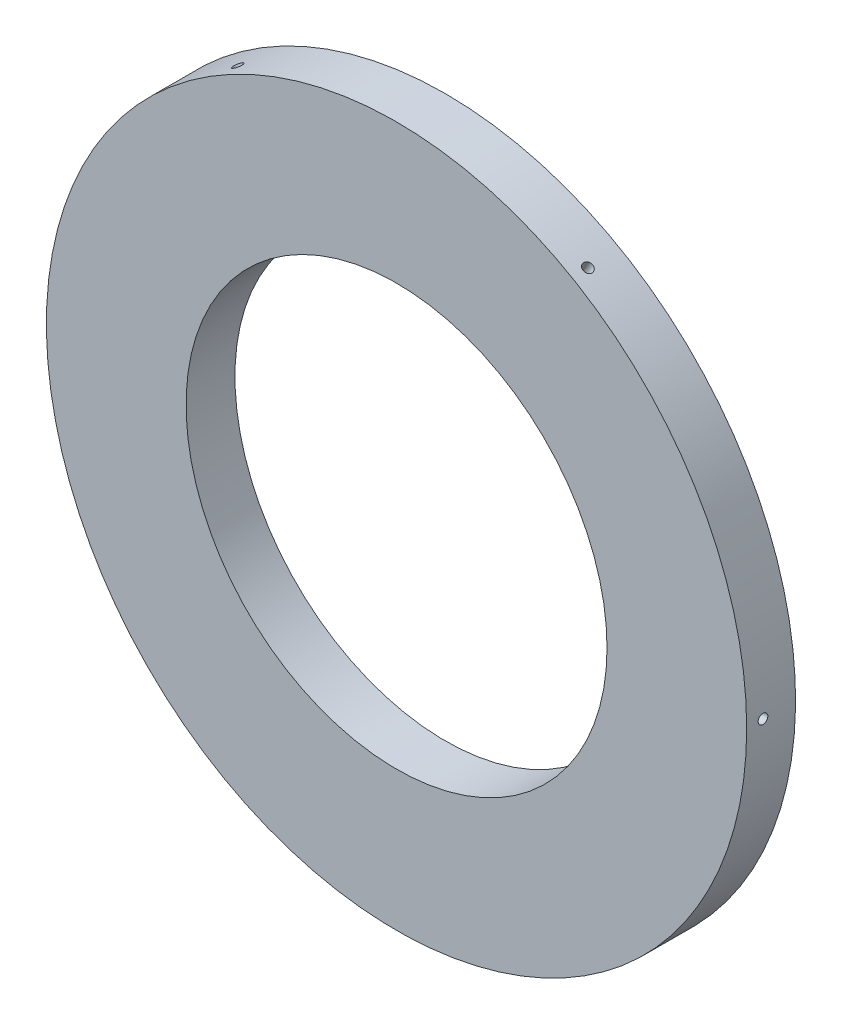
from build123d import *

# Parameters (mm, degrees)
SKETCH1_R                         = 81.8896
SKETCH1_R_2                       = 49.225199999999994
BOSS_EXTRUDE1_DEPTH               = 11.43
CIRPATTERN1_COUNT                 = 6
CUT_EXTRUDE1_DEPTH                = 10.921999999999999
FILLET2_R                         = 4.9276
FILLET4_R                         = 6.35
CIRPATTERN2_COUNT                 = 6
FILLET2_OF_CIRPATTERN2_R          = 4.9276
FILLET4_OF_CIRPATTERN2_R          = 6.35
BOSS_EXTRUDE2_DEPTH               = 19.05
CUT_EXTRUDE2_REACH                = 187.575
CUT_EXTRUDE2_END_RADIUS           = 81.8896
DRAFT1_ANGLE                      = -12.500000000000027
RIB5_REACH                        = 120.34
RIB6_DEPTH                        = 10.922
FILLET5_R                         = 2.54
CHAMFER2_SIZE                     = 5.08
CHAMFER4_SIZE                     = 5.08
TAPPED_HOLE_FOR_10_24_HELICOIL1_D = 5.15874
FILLET6_R                         = 6.35
FILLET13_R                        = 4.9276
FILLET14_R                        = 1.5875
FILLET15_R                        = 1.5875


with BuildPart() as part:
    # Sketch1 → Boss-Extrude1 (new body)
    with BuildSketch(Plane.XY):
        Circle(SKETCH1_R)
        Circle(SKETCH1_R_2, mode=Mode.SUBTRACT)
    extrude(amount=BOSS_EXTRUDE1_DEPTH)

    # Sketch2 → #4-40 Tapped Hole1 (revolve, cut)
    with BuildSketch(Plane(origin=(81.8896, 0, 7.62), x_dir=(0, 0, -1), z_dir=(-1.2e-16, 1, 0))):
        Polygon((0, 0), (-2.03e-15, 8.273752757686852), (1.130299999999998, 7.594599999999999), (1.130299999999999, -1e-17), align=None)
    f_4_40_tapped_hole1 = revolve(axis=Axis((88.2396, 7.8e-16, 7.62), (-1, -1.2e-16, 0)), mode=Mode.SUBTRACT)

    # CirPattern1: #4-40 Tapped Hole1 ×6 about axis
    cirpattern1_axis = Axis((0, 0, 11.43), (0, 0, -1))
    for i in range(1, CIRPATTERN1_COUNT):
        add(f_4_40_tapped_hole1.rotate(cirpattern1_axis, i * 360 / CIRPATTERN1_COUNT), mode=Mode.SUBTRACT)

    # Sketch3 → Cut-Extrude1 (cut)
    with BuildSketch(Plane.XY):
        with BuildLine():
            ThreePointArc((27.78089806339295, 42.682326925688685), (44.10407573853007, 25.463500000000053), (50.85442844197543, 2.7178))
            Line((50.85442844197543, 2.7178), (81.08206364492705, 2.7178))
            ThreePointArc((81.08206364492705, 2.7177999999999995), (70.25856254806233, 40.56380000000017), (42.894715664868535, 68.86022690777371))
            Line((42.8947156648687, 68.86022690777364), (27.780898063392954, 42.682326925688685))
        make_face()
    cut_extrude1 = extrude(amount=CUT_EXTRUDE1_DEPTH, mode=Mode.SUBTRACT)

    # Fillet2
    fillet2_edges = [part.edges().sort_by_distance(p)[0] for p in [
        (81.08206364492705, 2.7177999999999995, 5.460999999999999),
        (42.89471566486861, 68.86022690777367, 5.460999999999999),
    ]]
    fillet(fillet2_edges, radius=FILLET2_R)

    # Fillet4
    fillet4_edges = [part.edges().sort_by_distance(p)[0] for p in [
        (50.85442844197543, 2.717800000000004, 5.460999999999999),
        (27.780898063392954, 42.682326925688685, 5.460999999999999),
    ]]
    fillet(fillet4_edges, radius=FILLET4_R)

    # CirPattern2: Cut-Extrude1 ×6 about axis
    cirpattern2_axis = Axis((2.013e-14, -3.353e-14, 0), (0, 0, 1))
    for i in range(1, CIRPATTERN2_COUNT):
        add(cut_extrude1.rotate(cirpattern2_axis, i * 360 / CIRPATTERN2_COUNT), mode=Mode.SUBTRACT)

    # Fillet2 of CirPattern2
    fillet2_of_cirpattern2_edges = [part.edges().sort_by_distance(p)[0] for p in [
        (38.18734798005816, 71.57802690777348, 5.460999999999999),
        (-38.18734798005847, 71.57802690777334, 5.460999999999999),
        (-42.89471566486885, 68.86022690777342, 5.460999999999999),
        (-81.08206364492706, 2.7177999999996447, 5.460999999999999),
        (-81.082063644927, -2.717800000000057, 5.460999999999999),
        (-42.89471566486858, -68.86022690777374, 5.460999999999999),
        (-38.187347980058156, -71.5780269077735, 5.460999999999999),
        (38.187347980058476, -71.5780269077734, 5.460999999999999),
        (42.89471566486892, -68.8602269077735, 5.460999999999999),
        (81.0820636449271, -2.7177999999996834, 5.460999999999999),
    ]]
    fillet(fillet2_of_cirpattern2_edges, radius=FILLET2_OF_CIRPATTERN2_R)

    # Fillet4 of CirPattern2
    fillet4_of_cirpattern2_edges = [part.edges().sort_by_distance(p)[0] for p in [
        (23.073530378582355, 45.40012692568858, 5.460999999999999),
        (-23.073530378582497, 45.40012692568852, 5.460999999999999),
        (-27.780898063393053, 42.68232692568854, 5.460999999999999),
        (-50.854428441975436, 2.7177999999998153, 5.460999999999999),
        (-50.85442844197539, -2.717800000000065, 5.460999999999999),
        (-27.780898063392918, -42.68232692568875, 5.460999999999999),
        (-23.073530378582326, -45.40012692568864, 5.460999999999999),
        (23.07353037858252, -45.4001269256886, 5.460999999999999),
        (27.78089806339311, -42.682326925688606, 5.460999999999999),
        (50.854428441975486, -2.7177999999998645, 5.460999999999999),
    ]]
    fillet(fillet4_of_cirpattern2_edges, radius=FILLET4_OF_CIRPATTERN2_R)


with BuildPart() as body_2:
    # Sketch5 → Boss-Extrude2 (new body)
    with BuildSketch(Plane(origin=(0, -83.82, 0), x_dir=(1, 0, 0), z_dir=(0, 1, 0))):
        Polygon((9.525, 16.510000000000016), (-9.525, 16.510000000000016), (-9.524999999999995, -11.429999999999993), (9.524999999999995, -11.429999999999993), align=None)
    extrude(amount=BOSS_EXTRUDE2_DEPTH)

    # Cut-Extrude2: up to this cylinder (the profile starts outside it)
    cut_extrude2_end = Plane(origin=(0, 0, 6.985), z_dir=(0, 0, -1)) * Cylinder(CUT_EXTRUDE2_END_RADIUS, 539.9292, mode=Mode.PRIVATE)
    # Sketch6 → Cut-Extrude2 (cut, up to the surface)
    with BuildSketch(Plane.XZ.offset(83.82), mode=Mode.PRIVATE) as cut_extrude2_sk1:
        Polygon((9.524999999999999, 11.43), (-9.525, 11.429999999999996), (-9.525, 2.5399999999999796), (9.525, 2.539999999999985), align=None)
    cut_extrude2_tool1 = extrude(cut_extrude2_sk1.sketch, amount=-CUT_EXTRUDE2_REACH, mode=Mode.PRIVATE) - cut_extrude2_end
    add(cut_extrude2_tool1.solids().sort_by_distance((0, -83.82, 6.985))[0], mode=Mode.SUBTRACT)

    # Draft1
    draft1_faces = [body_2.faces().sort_by_distance(p)[0] for p in [
        (9.524999999999999, -73.93618404946444, -2.952674581292372),
        (-9.524999999999999, -73.93618404946444, -2.9526745812923716),
    ]]
    draft(draft1_faces, Plane(origin=(0, -83.82, 0), x_dir=(0, 0, -1), z_dir=(0, -1, 0)), DRAFT1_ANGLE)

    # Combine2: union part
    add(part.part)

    # Sketch14 walls → Rib5 (add, up to next)
    with BuildSketch(Plane.XY, mode=Mode.PRIVATE) as rib5_sk1:
        Polygon((-106.27487502239977, 40.063543037019265), (75.6466556340094, -155.89211494552436), (78.4388638034492, -153.29988163455218), (-103.48266685295998, 42.65577634799143), align=None)
    rib5_tool1 = extrude(rib5_sk1.sketch, amount=RIB5_REACH, mode=Mode.PRIVATE) - body_2.part
    # Sketch14 walls → Rib5 (add, up to next)
    with BuildSketch(Plane.XY, mode=Mode.PRIVATE) as rib5_sk2:
        Polygon((103.48266685295998, 42.65577634799143), (-78.4388638034492, -153.29988163455218), (-75.6466556340094, -155.89211494552436), (106.27487502239977, 40.063543037019265), align=None)
    rib5_tool2 = extrude(rib5_sk2.sketch, amount=RIB5_REACH, mode=Mode.PRIVATE) - body_2.part
    add(rib5_tool1.solids().sort_by_distance((-13.918005609, -56.618169299, 0))[0])
    add(rib5_tool2.solids().sort_by_distance((13.918005609, -56.618169299, 0))[0])

    # Rib6: read off the stored shape, not the designer's step
    # Rib6 outline → Rib6 (add)
    with BuildSketch(Plane.XY):
        with BuildLine():
            ThreePointArc((36.089276142, -68.378179395), (22.448876522, -73.98688541), (7.991643943, -76.903477794))
            Line((7.991643943, -76.903477794), (8.821467426, -80.646569637))
            ThreePointArc((8.821467426, -80.646569637), (21.32821315, -78.273844965), (33.309834399, -73.973930638))
            ThreePointArc((33.309834399, -73.973930638), (35.699811536, -71.672888042), (36.089276142, -68.378179395))
        make_face()
        with BuildLine():
            ThreePointArc((-7.991643943, -76.903477794), (-22.448876522, -73.98688541), (-36.089276142, -68.378179395))
            ThreePointArc((-36.089276142, -68.378179395), (-35.699811536, -71.672888042), (-33.309834399, -73.973930638))
            ThreePointArc((-33.309834399, -73.973930638), (-21.32821315, -78.273844965), (-8.821467426, -80.646569637))
            Line((-8.821467426, -80.646569637), (-7.991643943, -76.903477794))
        make_face()
    extrude(amount=RIB6_DEPTH)

    # Fillet5
    fillet5_edges = [body_2.edges().sort_by_distance(p)[0] for p in [
        (-5.301716676651983, -64.77, -8.255000000000008),
        (5.301716676651981, -64.77, -8.255000000000008),
    ]]
    fillet(fillet5_edges, radius=FILLET5_R)

    # Chamfer2
    # the kernel refuses this chamfer: 5.08 mm, written as the material it takes off along each edge
    with BuildSketch(Plane(origin=(12.352599491279573, -96.57447707026523, -16.510000000000016), x_dir=(-0.9762960071199333, -0.2164396139381035, 0), z_dir=(-0.2164396139381035, 0.9762960071199333, 0))) as chamfer2_piece_1:
        Polygon((CHAMFER2_SIZE, 0), (3.47e-15, CHAMFER2_SIZE), (0, 0), align=None)
    extrude(amount=43.602258382179265, mode=Mode.SUBTRACT)
    with BuildSketch(Plane(origin=(3.263151153406198, -67.31, -16.510000000000016), x_dir=(0.9762960071199331, 0.21643961393810449, 0), z_dir=(0.21643961393810449, -0.9762960071199331, 0))) as chamfer2_piece_2_section:
        Polygon((0, 2.539999999999995), (2.540000000000004, CHAMFER2_SIZE), (2.540000000000004, 0), (0, 0), align=None)
    chamfer2_piece_2 = revolve(axis=Axis((3.263151153406198, -67.31, -16.510000000000016), (-1.9e-16, 0, 1)), revolution_arc=359.64000000000004, mode=Mode.PRIVATE)
    chamfer2_piece_2 = split(chamfer2_piece_2, bisect_by=Plane(origin=(2.023255224363881, -67.5848783097014, -15.240000000000014), z_dir=(0.6903455270798549, 0.15304591873303136, -0.7071067811865472)), keep=Keep.TOP, mode=Mode.PRIVATE)
    add(chamfer2_piece_2, mode=Mode.SUBTRACT)
    with BuildSketch(Plane(origin=(-3.2631511534061994, -67.31, -16.510000000000016), x_dir=(-0.9762960071199331, 0.21643961393810446, 0), z_dir=(-0.21643961393810446, -0.9762960071199331, 0))) as chamfer2_piece_3_section:
        Polygon((0, -2.5399999999999947), (2.5400000000000027, -CHAMFER2_SIZE), (2.5400000000000045, 0), (0, 0), align=None)
    chamfer2_piece_3 = revolve(axis=Axis((-3.2631511534061994, -67.31, -16.510000000000016), (-1.9e-16, 0, -1)), revolution_arc=359.64000000000004, mode=Mode.PRIVATE)
    chamfer2_piece_3 = split(chamfer2_piece_3, bisect_by=Plane(origin=(-2.023255224363885, -67.5848783097014, -15.240000000000018), z_dir=(-0.690345527079855, 0.15304591873303142, -0.7071067811865472)), keep=Keep.TOP, mode=Mode.PRIVATE)
    add(chamfer2_piece_3, mode=Mode.SUBTRACT)
    with BuildSketch(Plane(origin=(-12.352599491279577, -96.57447707026523, -16.510000000000016), x_dir=(0.9762960071199333, -0.2164396139381035, 0), z_dir=(0.2164396139381035, 0.9762960071199333, 0))) as chamfer2_piece_4:
        Polygon((CHAMFER2_SIZE, 0), (5.2e-15, -CHAMFER2_SIZE), (0, 0), align=None)
    extrude(amount=43.602258382179265, mode=Mode.SUBTRACT)

    # Chamfer4
    # the kernel refuses this chamfer: 5.08 mm, written as the material it takes off along each edge
    with BuildSketch(Plane(origin=(13.16252632280557, -64.77, -16.510000000000016), x_dir=(0, -1, 0), z_dir=(-1, 0, 0))) as chamfer4_piece_1:
        Polygon((CHAMFER4_SIZE, 0), (0, CHAMFER4_SIZE), (0, 0), align=None)
    extrude(amount=26.32505264561114, mode=Mode.SUBTRACT)

    # Tapped Hole for #10-24 Helicoil1 (through all)
    with Locations(Plane(origin=(0, -83.82, 0), x_dir=(-1, 0, 0), z_dir=(0, -1, 0))):
        with Locations((0, 6.985)):
            Hole(TAPPED_HOLE_FOR_10_24_HELICOIL1_D / 2)

    # Fillet6
    # the kernel refuses this fillet: 6.35 mm, written as the material it adds along each edge
    with BuildSketch(Plane(origin=(-8.98737366218518, -81.394924306226, 2.5399999999999787), x_dir=(-0.2164396139381115, -0.9762960071199314, 0), z_dir=(0, 0, -1))) as fillet6_piece_1:
        with BuildLine():
            CenterArc((6.73244457172076, 4.719410912938874), FILLET6_R, 177.3216568109399, 50.6842938965479)
            Line((0.3893812544007295, 5.016139328276832), (0.26251998805432714, 5.022073896583592))
            ThreePointArc((0.26251998805432714, 5.022073896583592), (0.10660406835947663, 2.514907443660255), (-0.12625738722977256, 0.0137139407141354))
            Line((-0.12625738722977256, 0.0137139407141354), (4.46e-15, -0.127000000000002))
            ThreePointArc((4.46e-15, -0.127000000000002), (1.241977676897384, -0.12700000000001324), (2.3989855694362427, -0.09438821825877644))
            Line((2.3989855694362427, -0.09438821825877644), (2.483955353794764, 4e-17))
        make_face()
    extrude(amount=2.5399999999999787)
    with BuildSketch(Plane(origin=(8.987373662185178, -81.394924306226, 2.5399999999999636), x_dir=(0.21643961393810524, -0.9762960071199328, 0), z_dir=(0, 0, -1))) as fillet6_piece_2:
        with BuildLine():
            CenterArc((6.7324445717207375, -4.719410912938884), FILLET6_R, 131.99404929251213, 50.684293896547615)
            Line((0.3893812544007048, -5.016139328276805), (0.26251998805430254, -5.022073896583563))
            ThreePointArc((0.26251998805430254, -5.022073896583563), (0.10660406835945245, -2.5149074436601544), (-0.12625738722977267, -0.01371394071413458))
            Line((-0.12625738722977267, -0.01371394071413458), (5.28e-15, 0.127000000000002))
            ThreePointArc((5.28e-15, 0.127000000000002), (1.241977676897385, 0.12700000000000528), (2.3989855694362254, 0.09438821825877702))
            Line((2.3989855694362254, 0.09438821825877702), (2.483955353794746, -1e-17))
        make_face()
    extrude(amount=2.5399999999999636)

    # Fillet13
    # the kernel refuses this fillet: 4.9276 mm, written as the material it adds along each edge
    with BuildSketch(Plane(origin=(36.089276142, -68.378179395, 0), x_dir=(-0.8997023083142723, -0.43650401649236853, 0), z_dir=(0, 0, 1))) as fillet13_piece_1:
        with BuildLine():
            CenterArc((5.077388821093244, -4.92476519271238), FILLET13_R, 88.05641964849586, 96.06254489329456)
            Line((0.16251650101173107, -5.278702810516082), (-0.32897073099641894, -5.314096572296456))
            ThreePointArc((-0.32897073099641894, -5.314096572296456), (-0.6040954243893578, -1.4936415765299378), (-0.4802264127376351, 0.11043101968713778))
            Line((-0.4802264127376351, 0.11043101968713778), (-0.01671213829783228, 0.4924765192712349))
            ThreePointArc((-0.01671213829783228, 0.4924765192712349), (2.622255102035756, 0.5372401720807408), (5.261222342369325, 0.4924765192712386))
            Line((5.261222342369325, 0.4924765192712386), (5.2445102040715, -5e-17))
        make_face()
    extrude(amount=10.922)
    with BuildSketch(Plane(origin=(-24.165131001008216, -48.38046278480156, 0), x_dir=(0.6803761971055543, -0.7328630365983699, 0), z_dir=(0, 0, 1))) as fillet13_piece_2:
        with BuildLine():
            CenterArc((6.104626588358464, -4.927599999999996), FILLET13_R, 89.99999999999993, 107.12695258927738)
            Line((1.3955430349967404, -6.37872847379483), (0.9246346796605656, -6.523841321174313))
            ThreePointArc((0.9246346796605656, -6.523841321174313), (-0.23372616401248678, -2.76482335942617), (-0.4893136933828917, 0.05817668835533786))
            Line((-0.4893136933828917, 0.05817668835533786), (-1.01e-15, 0.4927600000000011))
            Line((-1.01e-15, 0.4927600000000011), (6.104626588358468, 0.4927600000000013))
            Line((6.104626588358468, 0.4927600000000013), (6.104626588358469, 2e-16))
        make_face()
    extrude(amount=10.921999999999999)
    with BuildSketch(Plane(origin=(-20.089646665271175, -47.17050250458477, 0), x_dir=(0.9738552993578001, -0.22716922307550694, 0), z_dir=(0, 0, 1))) as fillet13_piece_3:
        with BuildLine():
            CenterArc((16.05810388120281, -4.886380395451694), FILLET13_R, 97.41609055087756, 138.58742600781255)
            Line((13.302875664440107, -8.971715049253586), (13.027352842763836, -9.380248514633776))
            Line((13.027352842763836, -9.380248514633776), (-0.27552282167627096, -0.40853346538019))
            Line((-0.27552282167627096, -0.40853346538019), (-0.0864876549958887, 0.48511060917414883))
            ThreePointArc((-0.0864876549958887, 0.48511060917414883), (2.038518779848387, 0.528664017010486), (15.358475870725885, 0.48863803954517043))
            Line((15.358475870725885, 0.48863803954517043), (15.422078417132878, 1.4e-16))
        make_face()
    extrude(amount=10.921999999999999)
    with BuildSketch(Plane(origin=(20.089646665271204, -47.17050250458475, 0), x_dir=(-0.6803761971055534, -0.7328630365983709, 0), z_dir=(0, 0, 1))) as fillet13_piece_4:
        with BuildLine():
            CenterArc((16.045503166574658, -4.9276), FILLET13_R, 90, 138.58742600781216)
            Line((12.786011728054884, -8.623132075657887), (12.460062584202907, -8.992685283223679))
            ThreePointArc((12.460062584202907, -8.992685283223679), (1.3944803549163112, -1.5781219846475925), (-0.34295020958038064, -0.35383268835535164))
            Line((-0.34295020958038064, -0.35383268835535164), (1.68e-15, 0.49276000000000114))
            Line((1.68e-15, 0.49276000000000114), (16.04550316657466, 0.49276000000000136))
            Line((16.04550316657466, 0.49276000000000136), (16.045503166574658, 7e-17))
        make_face()
    extrude(amount=10.921999999999999)
    with BuildSketch(Plane(origin=(6.004862227203287, -67.94168461418383, 0), x_dir=(0.6803761971055519, 0.7328630365983723, 0), z_dir=(-1.5e-16, -1.7e-16, 1))) as fillet13_piece_5:
        with BuildLine():
            CenterArc((FILLET13_R * 0.524711737237, -FILLET13_R), FILLET13_R, 89.99999999999982, 55.37304741072275)
            Line((-FILLET13_R * 0.298157420048, -FILLET13_R * 0.431769105037), (0, 0))
            Line((0, 0), (FILLET13_R * 0.524711737237, -1e-17))
        make_face()
    extrude(amount=10.921999999999999)
    with BuildSketch(Plane(origin=(24.16513100100832, -48.38046278480145, 0), x_dir=(0.5705155382260753, -0.82128680778557, 0), z_dir=(0, 0, 1))) as fillet13_piece_6:
        with BuildLine():
            CenterArc((6.1184563016140965, -4.910417500430183), FILLET13_R, 85.21381637033207, 107.12695258927724)
            Line((1.3047146848114266, -5.963571528415652), (0.823340523131158, -6.068886931214197))
            Line((0.823340523131158, -6.068886931214197), (-0.48137416168026853, -0.10531540279854538))
            Line((-0.48137416168026853, -0.10531540279854538), (-0.16141128196252608, 0.4655736414953215))
            ThreePointArc((-0.16141128196252608, 0.4655736414953215), (2.65098539193584, 0.8192390251421976), (6.570717835549382, 0.49104175004301753))
            Line((6.570717835549382, 0.49104175004301753), (6.529603150646175, 2.1e-16))
        make_face()
    extrude(amount=10.921999999999999)
    with BuildSketch(Plane(origin=(7.991643942999998, -76.903477794, 0), x_dir=(0.9910620041531046, 0.13340203868019285, 0), z_dir=(0, 0, 1))) as fillet13_piece_7:
        with BuildLine():
            CenterArc((4.528671664667113, 4.925344936317466), FILLET13_R, 184.83377232942405, 86.89969585944255)
            Line((-0.3814026519032084, 4.510119737471706), (0, 0))
            ThreePointArc((0, 0), (2.338866058235255, -0.03538357654502479), (4.677732116470508, 3e-17))
        make_face()
    extrude(amount=10.922)
    with BuildSketch(Plane(origin=(-6.004862227203257, -67.94168461418384, 10.921999999999999), x_dir=(-0.6803761971055597, 0.732863036598365, 0), z_dir=(-1.5e-16, 1.7e-16, -1))) as fillet13_piece_8:
        with BuildLine():
            CenterArc((FILLET13_R * 0.524711737237, -FILLET13_R), FILLET13_R, 90.00000000000043, 55.37304741072205)
            Line((-FILLET13_R * 0.298157420048, -FILLET13_R * 0.431769105037), (0, 0))
            Line((0, 0), (FILLET13_R * 0.524711737237, 1.1e-16))
        make_face()
    extrude(amount=10.921999999999999)
    with BuildSketch(Plane(origin=(-7.991643943, -76.903477794, 0), x_dir=(-0.9910620041531039, 0.13340203868019804, 0), z_dir=(0, 0, 1))) as fillet13_piece_9:
        with BuildLine():
            CenterArc((4.528671664667768, -4.9253449363174715), FILLET13_R, 88.26653181113323, 86.89969585941017)
            Line((-0.3814026519023155, -4.510119737468924), (0, 0))
            ThreePointArc((0, 0), (2.338866058235586, 0.03538357654503865), (4.677732116471177, 3e-17))
        make_face()
    extrude(amount=10.922)
    with BuildSketch(Plane(origin=(-36.089276142, -68.378179395, 0), x_dir=(0.46398349337717193, 0.885843845084175, 0), z_dir=(0, 0, 1))) as fillet13_piece_10:
        with BuildLine():
            CenterArc((5.078677451782053, -4.923436278116847), FILLET13_R, 87.64445530544918, 96.06254489329501)
            Line((0.16138733872209915, -5.242026460016491), (-0.330341672583895, -5.273885478206455))
            ThreePointArc((-0.330341672583895, -5.273885478206455), (-0.45629207150843853, -2.6375455196316713), (-0.4927575639903392, 0.00154942902505477))
            Line((-0.4927575639903392, 0.00154942902505477), (-0.12515654739936588, 0.4766007304264952))
            ThreePointArc((-0.12515654739936588, 0.4766007304264952), (1.4743446026802265, 0.6497726013418448), (5.301456580384166, 0.4923436278116839))
            Line((5.301456580384166, 0.4923436278116839), (5.281203932329427, -1.9e-16))
        make_face()
    extrude(amount=10.922)
    with BuildSketch(Plane(origin=(3.7132815464943043, -64.81020348243734, 0), x_dir=(-0.999818826942852, 0.01903452890458496, 0), z_dir=(-1.9e-16, 0, 1))) as fillet13_piece_11:
        with BuildLine():
            CenterArc((2.2059288999840274, -4.926707251643595), FILLET13_R, 91.0906640383608, 47.12695258927742)
            Line((-1.4684883124714792, -1.6434314623120472), (-1.8359300337170295, -1.3151038833788902))
            Line((-1.8359300337170295, -1.3151038833788902), (-0.3674417212455502, 0.3283275789331499))
            Line((-0.3674417212455502, 0.3283275789331499), (0.07807848014879236, 0.48653485850209904))
            ThreePointArc((0.07807848014879236, 0.48653485850209904), (0.4414346414741736, 0.46104254649290405), (2.1027549008907713, 0.49267072516436383))
            Line((2.1027549008907713, 0.49267072516436383), (2.1121343553537946, 0))
        make_face()
    extrude(amount=10.922)
    with BuildSketch(Plane(origin=(-3.713281546494297, -64.81020348243734, 0), x_dir=(-0.680376197105556, 0.7328630365983685, 0), z_dir=(1.9e-16, 0, 1))) as fillet13_piece_12:
        with BuildLine():
            CenterArc((2.2039339588976476, -4.927600000000002), FILLET13_R, 89.99999999999989, 47.126952589277266)
            Line((-1.4073219402444683, -1.5749782511426615), (-1.7684475301586833, -1.2397160762569246))
            ThreePointArc((-1.7684475301586833, -1.2397160762569246), (-0.6379199487442616, -0.02197524434914968), (-0.4148236955272428, 0.2659581155541677))
            Line((-0.4148236955272428, 0.2659581155541677), (5.26e-15, 0.4927599999999963))
            Line((5.26e-15, 0.4927599999999963), (2.2039339588976583, 0.492760000000001))
            Line((2.2039339588976583, 0.492760000000001), (2.2039339588976583, -3e-17))
        make_face()
    extrude(amount=10.922)

    # Fillet14
    fillet14_edges = [body_2.edges().sort_by_distance(p)[0] for p in [
        (7.192726996136237, -61.06234021392362, 10.922),
        (-1.1509e-13, -64.77, 10.921999999999999),
        (-7.1927269961364, -61.06234021392343, 10.922),
        (-1.07763e-12, -50.927000000000035, 10.921999999999999),
        (9.97433107367349, -53.384460815399805, 10.922),
        (-9.97433107367998, -53.38446081541017, 10.922),
        (-3.571410919227707, -64.35912562204399, 10.922),
        (3.5714109192274464, -64.35912562204385, 10.922),
        (30.764627874571257, -58.72149855470679, 10.921999999999999),
        (22.177405248337724, -74.06871111489973, 10.922),
        (6.788236501273954, -71.47525761378456, 10.921999999999999),
        (13.887855293708107, -59.45056711069133, 10.922),
        (9.063733586337303, -75.50077359312931, 10.922),
        (24.17534004242952, -51.31040004876251, 10.922),
        (6.619759084689781, -68.10859309944843, 10.922),
        (34.05705219704629, -67.68892719636477, 10.922),
        (-30.76462787457137, -58.7214985547074, 10.921999999999999),
        (-22.177405248337987, -74.06871111489963, 10.922),
        (-13.887855293707979, -59.450567110691466, 10.922),
        (-6.788236501274282, -71.47525761378603, 10.922),
        (-34.05705219704547, -67.68892719636506, 10.922),
        (-9.063733586339469, -75.50077359312998, 10.922),
        (-6.619759084689781, -68.10859309944843, 10.922),
        (-24.17534004242888, -51.310400048763405, 10.922),
    ]]
    fillet(fillet14_edges, radius=FILLET14_R)

    # Fillet15
    fillet15_edges = [body_2.edges().sort_by_distance(p)[0] for p in [
        (66.18507353377304, 2.7178, 10.921999999999999),
        (70.25856254806236, 40.56380000000009, 10.921999999999999),
        (44.10407573853008, 25.463500000000057, 10.921999999999999),
        (29.885508331465545, 43.292622800395286, 10.921999999999999),
        (35.44622060929171, 55.95905503158863, 10.921999999999999),
        (43.49418650408965, 66.65318561307464, 10.921999999999999),
        (79.47044523612693, 4.340477622942812, 10.921999999999999),
        (52.435265307332486, 4.235298019863146, 10.921999999999999),
        (35.44622060929191, -55.959055031588555, 10.921999999999999),
        (70.25856254806251, -40.56379999999989, 10.921999999999999),
        (44.104075738530184, -25.46349999999994, 10.921999999999999),
        (52.435265307332536, -4.235298019863001, 10.921999999999999),
        (66.18507353377308, -2.7177999999998184, 10.921999999999999),
        (79.47044523612698, -4.34047762294259, 10.921999999999999),
        (43.49418650408988, -66.65318561307454, 10.921999999999999),
        (29.885508331465697, -43.2926228003952, 10.921999999999999),
        (-66.18507353377298, -2.717800000000059, 10.921999999999999),
        (-70.25856254806232, -40.56380000000014, 10.921999999999999),
        (-44.104075738530035, -25.46350000000012, 10.921999999999999),
        (-29.88550833146551, -43.29262280039534, 10.921999999999999),
        (-35.44622060929167, -55.95905503158868, 10.921999999999999),
        (-43.49418650408961, -66.6531856130747, 10.921999999999999),
        (-79.47044523612689, -4.340477622942863, 10.921999999999999),
        (-52.43526530733244, -4.235298019863207, 10.921999999999999),
        (-35.44622060929184, 55.959055031588484, 10.921999999999999),
        (-70.25856254806247, 40.563799999999844, 10.921999999999999),
        (-44.10407573853013, 25.463499999999893, 10.921999999999999),
        (-52.4352653073325, 4.235298019862956, 10.921999999999999),
        (-66.18507353377304, 2.717799999999776, 10.921999999999999),
        (-79.47044523612692, 4.3404776229425455, 10.921999999999999),
        (-43.494186504089804, 66.65318561307447, 10.921999999999999),
        (-29.885508331465655, 43.29262280039515, 10.921999999999999),
        (30.73885292448116, 58.67685503158852, 10.921999999999999),
        (-1.3266e-13, 81.12759999999996, 10.921999999999999),
        (-8.292e-14, 50.926999999999964, 10.921999999999999),
        (-22.549756975866973, 47.527920820258274, 10.921999999999999),
        (-30.73885292448133, 58.67685503158844, 10.921999999999999),
        (-35.976258732037294, 70.99366323601723, 10.921999999999999),
        (35.97625873203708, 70.99366323601733, 10.921999999999999),
        (22.549756975866813, 47.527920820258316, 10.921999999999999),
    ]]
    fillet(fillet15_edges, radius=FILLET15_R)


solid = body_2.part
